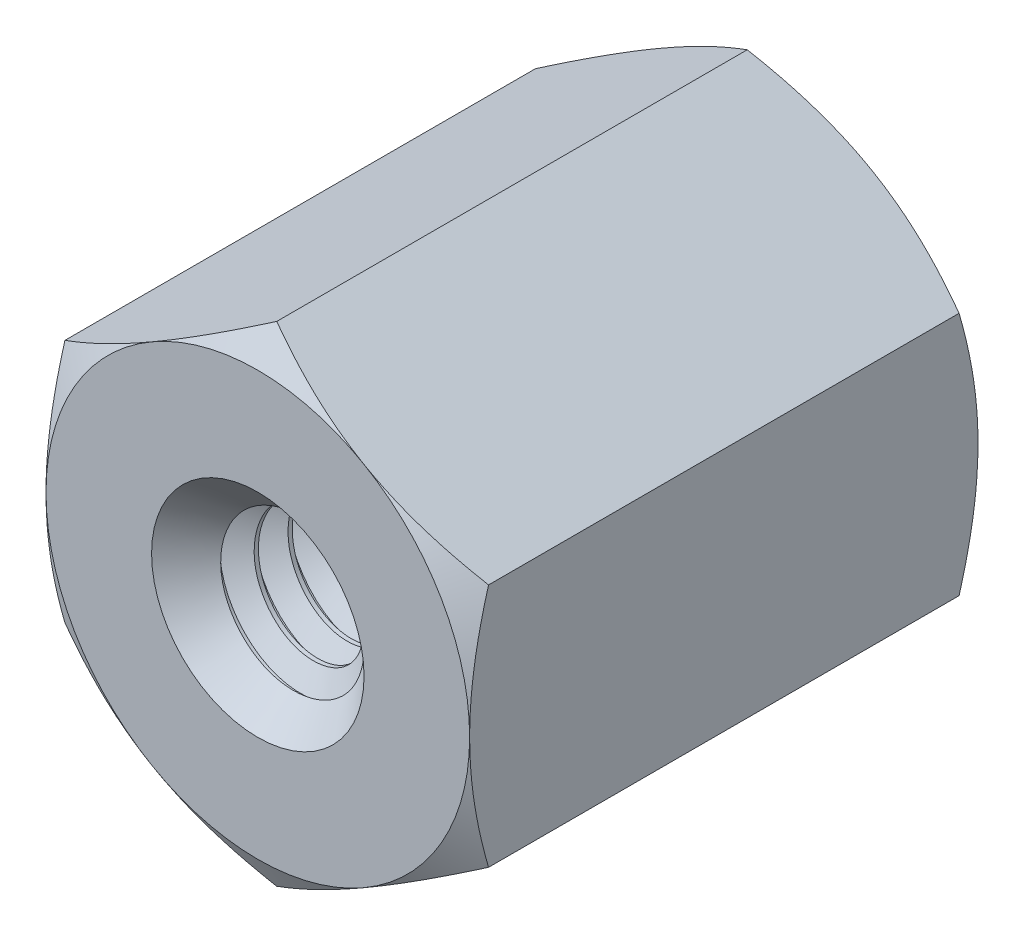
from build123d import *

# Parameters (mm, degrees)
EXTRUDE1_DEPTH     = 6
SKETCH2_OUTSIDE_W  = 37.044
SKETCH2_OUTSIDE_H  = 37.818
SKETCH2_OUTSIDE_R  = 2.5
CUT_EXTRUDE1_DEPTH = 8.112196098
CUT_EXTRUDE1_DRAFT = -60
SKETCH3_OUTSIDE_W  = 37.044
SKETCH3_OUTSIDE_H  = 37.818
SKETCH3_OUTSIDE_R  = 2.5
CUT_EXTRUDE2_DEPTH = 8.112196098
CUT_EXTRUDE2_DRAFT = -60
SKETCH4_R          = 1
CUT_EXTRUDE3_DEPTH = 8.112196098
SKETCH12_R         = 1
SKETCH12_R_2       = 0.740192379
EXTRUDE2_DEPTH     = 6
CUT_SWEEP1_PITCH   = 0.4


with BuildPart() as part:
    # Sketch1 → Extrude1 (new body)
    with BuildSketch(Plane.XY):
        Polygon((0, 2.886751346), (-2.5, 1.443375673), (-2.5, -1.443375673), (0, -2.886751346), (2.5, -1.443375673), (2.5, 1.443375673), align=None)
    extrude(amount=-EXTRUDE1_DEPTH)


with BuildPart() as cut_extrude1_tool:
    # Sketch2 outside → Cut-Extrude1 (with draft: the straight prism first)
    with BuildSketch(Plane.XY):
        Rectangle(SKETCH2_OUTSIDE_W, SKETCH2_OUTSIDE_H)
        Circle(SKETCH2_OUTSIDE_R, mode=Mode.SUBTRACT)
    extrude(amount=-CUT_EXTRUDE1_DEPTH)
    # Cut-Extrude1: the draft: its side faces are tilted about the plane it starts from
    cut_extrude1_sides = [cut_extrude1_tool.faces().sort_by_distance(p)[0] for p in [
        (0, -18.909, -4.056098049),
        (18.522, 0, -4.056098049),
        (0, 18.909, -4.056098049),
        (-18.522, 0, -4.056098049),
        (-2.5, 0, -4.056098049),
    ]]
    draft(cut_extrude1_sides, Plane.XY, CUT_EXTRUDE1_DRAFT)


with BuildPart() as part_1:
    add(part.part)

    # Cut-Extrude1: cut by cut_extrude1_tool
    add(cut_extrude1_tool.part, mode=Mode.SUBTRACT)


with BuildPart() as cut_extrude2_tool:
    # Sketch3 outside → Cut-Extrude2 (with draft: the straight prism first)
    with BuildSketch(Plane(origin=(0, 0, -6), x_dir=(-1, 0, 0), z_dir=(0, 0, -1))):
        Rectangle(SKETCH3_OUTSIDE_W, SKETCH3_OUTSIDE_H)
        Circle(SKETCH3_OUTSIDE_R, mode=Mode.SUBTRACT)
    extrude(amount=-CUT_EXTRUDE2_DEPTH)
    # Cut-Extrude2: the draft: its side faces are tilted about the plane it starts from
    cut_extrude2_sides = [cut_extrude2_tool.faces().sort_by_distance(p)[0] for p in [
        (0, -18.909, -1.943901951),
        (-18.522, 0, -1.943901951),
        (0, 18.909, -1.943901951),
        (18.522, 0, -1.943901951),
        (2.5, 0, -1.943901951),
    ]]
    draft(cut_extrude2_sides, Plane(origin=(0, 0, -6), x_dir=(-1, 0, 0), z_dir=(0, 0, -1)), CUT_EXTRUDE2_DRAFT)


with BuildPart() as part_2:
    add(part_1.part)

    # Cut-Extrude2: cut by cut_extrude2_tool
    add(cut_extrude2_tool.part, mode=Mode.SUBTRACT)

    # Sketch4 → Cut-Extrude3 (cut, through all)
    with BuildSketch(Plane.XY):
        Circle(SKETCH4_R)
    extrude(amount=-CUT_EXTRUDE3_DEPTH, mode=Mode.SUBTRACT)

    # Sketch12 → Extrude2 (add)
    with BuildSketch(Plane.XY):
        Circle(SKETCH12_R)
        Circle(SKETCH12_R_2, mode=Mode.SUBTRACT)
    extrude(amount=-EXTRUDE2_DEPTH)

    # Cut-Sweep1: the profile of Sketch9 profile screwed along a right-hand helix of 16 turns, 6 arcs to a turn; built about Z, then put on its axis
    cut_sweep1_z = Axis((0, 0, 0), (0, 0, 1))
    cut_sweep1_corners = [(1, 0, -0.2), (1, 0, -0.15), (0.739892379, 0, 0.000173205), (0.739892379, 0, -0.350173205)]
    with BuildLine(mode=Mode.PRIVATE) as cut_sweep1_profile:
        Line(cut_sweep1_corners[0], cut_sweep1_corners[1])
        Line(cut_sweep1_corners[1], cut_sweep1_corners[2])
        Line(cut_sweep1_corners[2], cut_sweep1_corners[3])
        Line(cut_sweep1_corners[3], cut_sweep1_corners[0])
    cut_sweep1_cap = Face(cut_sweep1_profile.wire())
    cut_sweep1_turn_angles = [0, 30, 60, 90, 120, 150, 180, 210, 240, 270, 300, 330, 360]
    cut_sweep1_turn_weights = [1, 0.8660254037844387, 1, 0.8660254037844387, 1, 0.8660254037844387, 1, 0.8660254037844387, 1, 0.8660254037844387, 1, 0.8660254037844387, 1]
    cut_sweep1_turn_rails = [Edge.make_bspline([Vector(p[0], p[1], 0).rotate(cut_sweep1_z, cut_sweep1_turn_angles[k]) / cut_sweep1_turn_weights[k] + Vector(0, 0, p[2] + CUT_SWEEP1_PITCH * cut_sweep1_turn_angles[k] / 360) for k in range(13)], [0, 0, 0, 1, 1, 2, 2, 3, 3, 4, 4, 5, 5, 6, 6, 6], 2, cut_sweep1_turn_weights) for p in cut_sweep1_corners]
    cut_sweep1_turn_sides = [Face.make_surface_from_curves(cut_sweep1_turn_rails[p[0]], cut_sweep1_turn_rails[p[1]]) for p in [(0, 1), (1, 2), (2, 3), (3, 0)]]
    cut_sweep1 = Plane(origin=(0, 0, 0), x_dir=(0, 1, 0), z_dir=(0, 0, -1)) * Solid(Shell([*[p.moved(Location((0, 0, CUT_SWEEP1_PITCH * i))) for i in range(16) for p in cut_sweep1_turn_sides], cut_sweep1_cap, cut_sweep1_cap.rotate(cut_sweep1_z, 5760).moved(Location((0, 0, CUT_SWEEP1_PITCH * 5760 / 360)))]))
    add(cut_sweep1, mode=Mode.SUBTRACT)

    # Cut-Extrude6 cone 1 section (through the dimple's axis) → Cut-Extrude6 (revolve, cut)
    with BuildSketch(Plane(origin=(0, 0, 0), x_dir=(0, -1, 0), z_dir=(1, 0, 0))):
        Polygon((0, 0), (1.254, 0), (0, 1.254), align=None)
    revolve(axis=Axis((0, 0, 0), (0, 0, -1)), mode=Mode.SUBTRACT)

    # Cut-Extrude7 cone 1 section (through the dimple's axis) → Cut-Extrude7 (revolve, cut)
    with BuildSketch(Plane(origin=(0, 0, -6), x_dir=(0, 1, 0), z_dir=(1, 0, 0))):
        Polygon((0, 0), (1.254, 0), (0, 1.254), align=None)
    revolve(axis=Axis((0, 0, -6), (0, 0, 1)), mode=Mode.SUBTRACT)


solid = part_2.part
